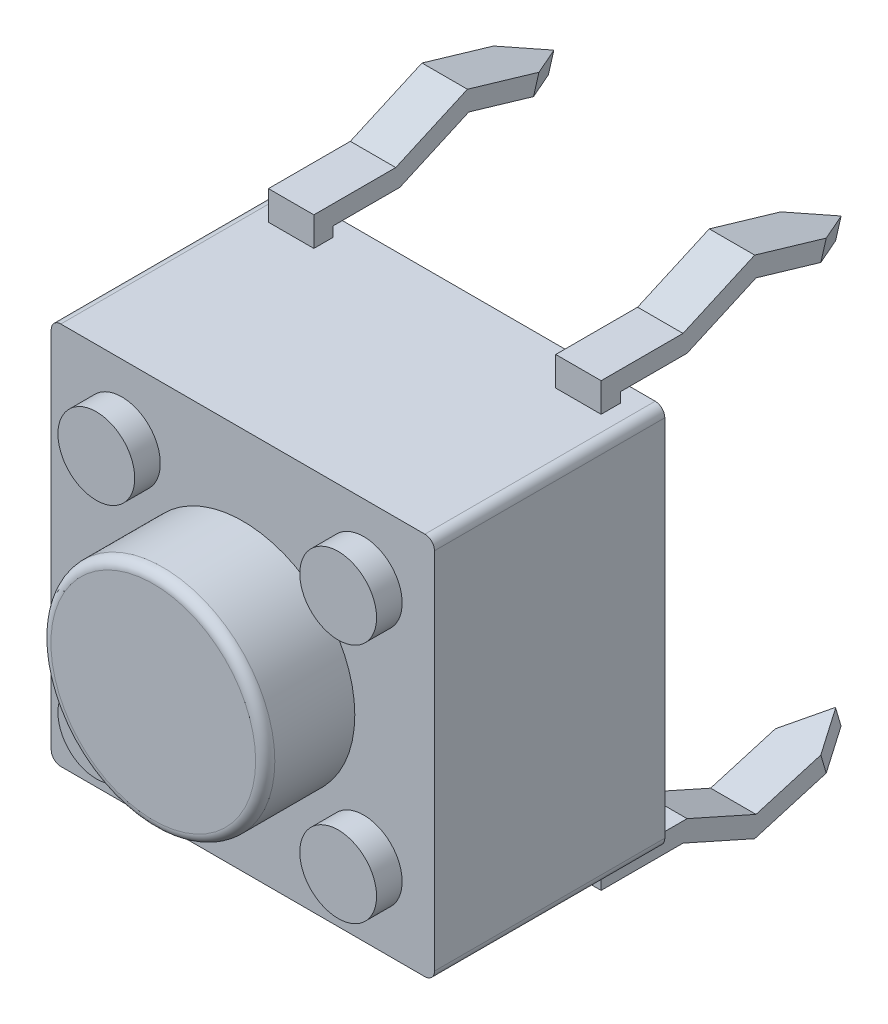
from build123d import *

# Parameters (mm, degrees)
SKETCH2_W                 = 5.99
SKETCH2_H                 = 5.99
BOSS_EXTRUDE1_DEPTH       = 3.6
SKETCH3_R                 = 1.75
BOSS_EXTRUDE2_DEPTH       = 1.4
EXTRUDE_THIN1_DEPTH       = 0.355
CHAMFER2_SIZE             = 0.35
CHAMFER2_SIZE2            = 0.606217783
CHAMFER2_OF_MIRROR1_SIZE2 = 0.35
CHAMFER2_OF_MIRROR1_SIZE  = 0.606217783
FILLET1_R                 = 0.15
SKETCH5_R                 = 0.6
BOSS_EXTRUDE3_DEPTH       = 0.4


# Read off the part's stored shape, not the designer's step: Mirror2
with BuildPart() as part:
    # Sketch2 → Boss-Extrude1 (new body)
    with BuildSketch(Plane.XY):
        with Locations((2.995, 2.995)):
            Rectangle(SKETCH2_W, SKETCH2_H)
    extrude(amount=BOSS_EXTRUDE1_DEPTH)

    # Sketch3 → Boss-Extrude2 (add)
    with BuildSketch(Plane.XY.offset(3.6)):
        with Locations(Location((2.995, 2.995, 0), (0, 0, 180))):
            Circle(SKETCH3_R)
    extrude(amount=BOSS_EXTRUDE2_DEPTH)

    # Sketch4 → Extrude-Thin1 (add, symmetric)
    with BuildSketch(Plane(origin=(5.24, 0, 0), x_dir=(0, 0, -1), z_dir=(1, 0, 0))):
        Polygon((-0.6, 5.99), (-0.6, 6.445), (0.68, 6.445), (1.8, 6.945), (3.5, 6.445), (3.415350103, 6.15719035), (1.821377167, 6.626005919), (0.743923909, 6.145), (-0.3, 6.145), (-0.3, 5.99), align=None)
    extrude_thin1 = extrude(amount=EXTRUDE_THIN1_DEPTH, both=True)

    # Chamfer2
    chamfer2_edges = [part.edges().sort_by_distance(p)[0] for p in [
        (5.595, 6.301095175, -3.457675051),
        (4.885, 6.301095175, -3.457675051),
    ]]
    chamfer2_side = [part.faces().sort_by_distance(p)[0] for p in [
        (5.24, 6.301095175, -3.457675051),
    ]]
    chamfer(chamfer2_edges, length=CHAMFER2_SIZE, length2=CHAMFER2_SIZE2, reference=chamfer2_side[0])

    # Mirror1: Extrude-Thin1 across plane
    add(extrude_thin1.mirror(Plane(origin=(2.995, 0, 0), x_dir=(0, 0, 1), z_dir=(1, 0, 0))))

    # Chamfer2 of Mirror1
    chamfer2_of_mirror1_edges = [part.edges().sort_by_distance(p)[0] for p in [
        (0.395, 6.301095175, -3.457675051),
        (1.105, 6.301095175, -3.457675051),
    ]]
    chamfer(chamfer2_of_mirror1_edges, length=CHAMFER2_OF_MIRROR1_SIZE, length2=CHAMFER2_OF_MIRROR1_SIZE2)

    # Mirror2: part across plane


with BuildPart() as part_1:
    add(part.part)
    add(part.part.mirror(Plane.ZX.offset(2.995)))

    # Fillet1
    fillet1_edges = [part_1.edges().sort_by_distance(p)[0] for p in [
        (4.745, 2.995, 5),
        (0, 5.99, 1.8),
        (5.99, 5.99, 1.8),
        (5.99, 0, 1.8),
        (0, 0, 1.8),
    ]]
    fillet(fillet1_edges, radius=FILLET1_R)

    # Sketch5 → Boss-Extrude3 (add)
    with BuildSketch(Plane.XY.offset(3.6)):
        with Locations(Location((1.105, 4.88, 0), (0, 0, 180))):
            Circle(SKETCH5_R)
        with Locations(Location((4.885, 4.88, 0), (0, 0, 180))):
            Circle(SKETCH5_R)
        with Locations(Location((4.885, 1.11, 0), (0, 0, 180))):
            Circle(SKETCH5_R)
        with Locations(Location((1.105, 1.11, 0), (0, 0, 180))):
            Circle(SKETCH5_R)
    extrude(amount=BOSS_EXTRUDE3_DEPTH)


solid = part_1.part
